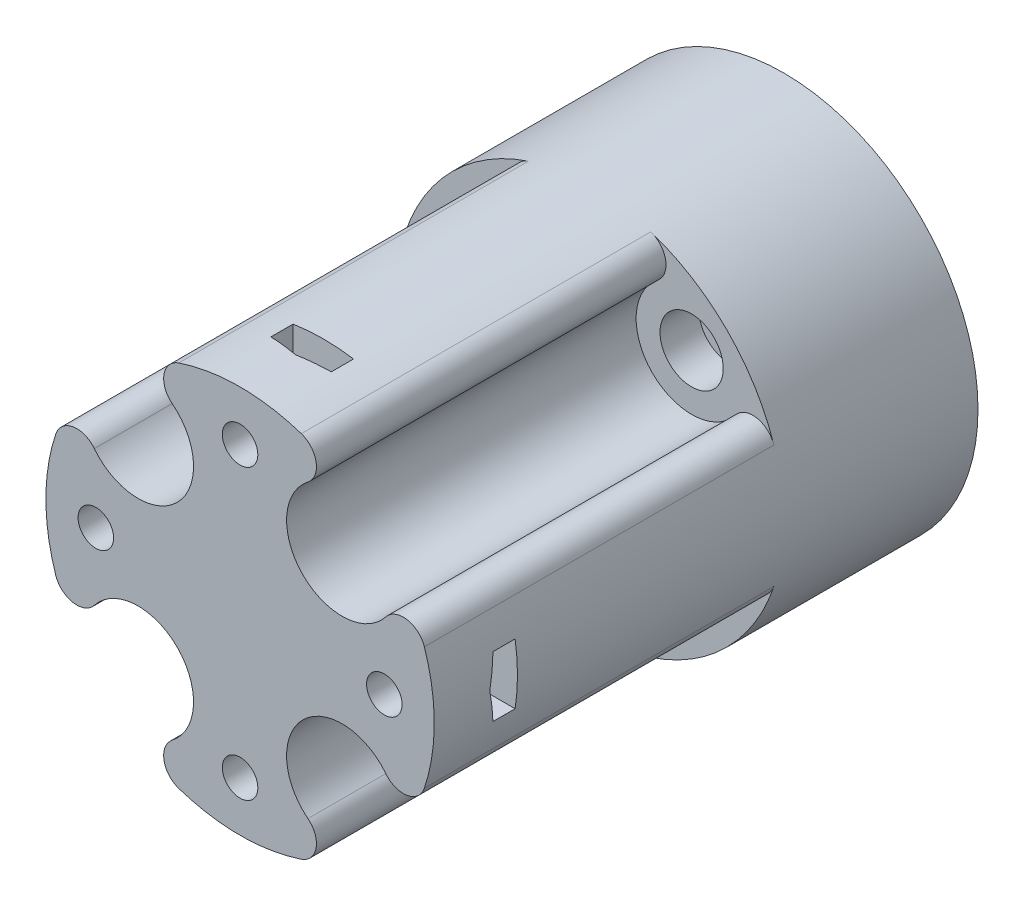
from build123d import *

# Parameters (mm, degrees)
SKETCH1_R                = 17.5
SKETCH1_R_2              = 2.85
BOSS_EXTRUDE1_DEPTH      = 48
BOSS_EXTRUDE3_START      = -1
SKETCH1_4_R              = 17.5
SKETCH1_4_R_2            = 2.85
BOSS_EXTRUDE3_DEPTH      = 1
BOSS_EXTRUDE2_DEPTH      = 13
BOSS_EXTRUDE2_DEPTH_BACK = 1
SKETCH1_3_R              = 2.85
SKETCH1_3_R_2            = 1.6
SKETCH2_R                = 5
CUT_EXTRUDE1_DEPTH       = 31.5
FILLET1_R                = 2
CUT_EXTRUDE2_START       = -7.5
SKETCH3_R                = 1.6
CUT_EXTRUDE2_DEPTH       = 2.5
CUT_EXTRUDE3_START       = -10
SKETCH3_2_R              = 1.6
CUT_EXTRUDE3_DEPTH       = 10
CHAMFER1_SIZE            = 2.75
CHAMFER1_SIZE_2          = 0.5


with BuildPart() as part:
    # Sketch1 → Boss-Extrude1 (new body)
    with BuildSketch(Plane(origin=(0, 0, 0), x_dir=(0, 1, 0), z_dir=(0, 0, 1))):
        with Locations(Location((0, 0, 0), (0, 0, 270))):
            Circle(SKETCH1_R)
        with Locations(Location((-9.192388155, 9.192388155, 0), (0, 0, 270))):
            Circle(SKETCH1_R_2, mode=Mode.SUBTRACT)
        with Locations(Location((-9.192388155, -9.192388155, 0), (0, 0, 270))):
            Circle(SKETCH1_R_2, mode=Mode.SUBTRACT)
        with Locations(Location((9.192388155, -9.192388155, 0), (0, 0, 270))):
            Circle(SKETCH1_R_2, mode=Mode.SUBTRACT)
        with Locations(Location((9.192388155, 9.192388155, 0), (0, 0, 270))):
            Circle(SKETCH1_R_2, mode=Mode.SUBTRACT)
    extrude(amount=BOSS_EXTRUDE1_DEPTH)

    # Sketch1<4> → Boss-Extrude3 (add)
    with BuildSketch(Plane(origin=(0, 0, 0), x_dir=(0, 1, 0), z_dir=(0, 0, 1)).offset(BOSS_EXTRUDE3_START)):
        with Locations(Location((0, 0, 0), (0, 0, 270))):
            Circle(SKETCH1_4_R)
        with Locations(Location((-9.192388155, 9.192388155, 0), (0, 0, 270))):
            Circle(SKETCH1_4_R_2, mode=Mode.SUBTRACT)
        with Locations(Location((-9.192388155, -9.192388155, 0), (0, 0, 270))):
            Circle(SKETCH1_4_R_2, mode=Mode.SUBTRACT)
        with Locations(Location((9.192388155, -9.192388155, 0), (0, 0, 270))):
            Circle(SKETCH1_4_R_2, mode=Mode.SUBTRACT)
        with Locations(Location((9.192388155, 9.192388155, 0), (0, 0, 270))):
            Circle(SKETCH1_4_R_2, mode=Mode.SUBTRACT)
    extrude(amount=BOSS_EXTRUDE3_DEPTH)

    # Sketch1<3> → Boss-Extrude2 (add, two sides: drawn at the far end of the back side and taken through both)
    # profile 1 of 4: a face of its own
    with BuildSketch(Plane(origin=(0, 0, 0), x_dir=(0, 1, 0), z_dir=(0, 0, 1)).offset(-BOSS_EXTRUDE2_DEPTH_BACK)):
        with Locations(Location((-9.192388155, -9.192388155, 0), (0, 0, 270))):
            Circle(SKETCH1_3_R)
        with Locations(Location((-9.192388155, -9.192388155, 0), (0, 0, 270))):
            Circle(SKETCH1_3_R_2, mode=Mode.SUBTRACT)
    # profile 2 of 4: a face of its own
    with BuildSketch(Plane(origin=(0, 0, 0), x_dir=(0, 1, 0), z_dir=(0, 0, 1)).offset(-BOSS_EXTRUDE2_DEPTH_BACK)):
        with Locations(Location((-9.192388155, 9.192388155, 0), (0, 0, 270))):
            Circle(SKETCH1_3_R)
        with Locations(Location((-9.192388155, 9.192388155, 0), (0, 0, 270))):
            Circle(SKETCH1_3_R_2, mode=Mode.SUBTRACT)
    # profile 3 of 4: a face of its own
    with BuildSketch(Plane(origin=(0, 0, 0), x_dir=(0, 1, 0), z_dir=(0, 0, 1)).offset(-BOSS_EXTRUDE2_DEPTH_BACK)):
        with Locations(Location((9.192388155, -9.192388155, 0), (0, 0, 270))):
            Circle(SKETCH1_3_R)
        with Locations(Location((9.192388155, -9.192388155, 0), (0, 0, 270))):
            Circle(SKETCH1_3_R_2, mode=Mode.SUBTRACT)
    # profile 4 of 4: a face of its own
    with BuildSketch(Plane(origin=(0, 0, 0), x_dir=(0, 1, 0), z_dir=(0, 0, 1)).offset(-BOSS_EXTRUDE2_DEPTH_BACK)):
        with Locations(Location((9.192388155, 9.192388155, 0), (0, 0, 270))):
            Circle(SKETCH1_3_R)
        with Locations(Location((9.192388155, 9.192388155, 0), (0, 0, 270))):
            Circle(SKETCH1_3_R_2, mode=Mode.SUBTRACT)
    extrude(amount=BOSS_EXTRUDE2_DEPTH + BOSS_EXTRUDE2_DEPTH_BACK)

    # Sketch2 → Cut-Extrude1 (cut)
    with BuildSketch(Plane.XY.offset(48)):
        with Locations((-9.192388155, 9.192388155)):
            Circle(SKETCH2_R)
        with Locations((9.192388155, 9.192388155)):
            Circle(SKETCH2_R)
        with Locations((9.192388155, -9.192388155)):
            Circle(SKETCH2_R)
        with Locations((-9.192388155, -9.192388155)):
            Circle(SKETCH2_R)
    extrude(amount=-CUT_EXTRUDE1_DEPTH, mode=Mode.SUBTRACT)

    # Fillet1
    fillet1_edges = [part.edges().sort_by_distance(p)[0] for p in [
        (14.028560913, -10.46181049, 32.25),
        (10.46181049, -14.028560913, 32.25),
        (10.46181049, 14.028560913, 32.25),
        (14.028560913, 10.46181049, 32.25),
        (-14.028560913, 10.46181049, 32.25),
        (-10.46181049, 14.028560913, 32.25),
        (-10.46181049, -14.028560913, 32.25),
        (-14.028560913, -10.46181049, 32.25),
    ]]
    fillet(fillet1_edges, radius=FILLET1_R)

    # Sketch3 → Cut-Extrude2 (cut)
    # profile 1 of 4: a face of its own
    with BuildSketch(Plane.XY.offset(48).offset(CUT_EXTRUDE2_START)):
        with BuildLine():
            Line((-2.725057077, 15.725171237), (-2.725057077, 17.286528394))
            ThreePointArc((-2.725057077, 17.286528394), (-5.7782e-05, 17.5), (2.724942923, 17.286546389))
            Line((2.724942923, 17.286546389), (2.724942923, 15.724942923))
            Line((2.724942923, 15.724942923), (2.724942923, 10.274942923))
            Line((2.724942923, 10.274942923), (-2.725057077, 10.274942923))
            Line((-2.725057077, 10.274942923), (-2.725057077, 15.725171237))
        make_face()
        with Locations((0, 13)):
            Circle(SKETCH3_R, mode=Mode.SUBTRACT)
    # profile 2 of 4: a face of its own
    with BuildSketch(Plane.XY.offset(48).offset(CUT_EXTRUDE2_START)):
        with BuildLine():
            Line((15.724942923, -2.724942923), (10.274942923, -2.724942923))
            Line((10.274942923, -2.724942923), (10.274942923, 2.725057077))
            Line((10.274942923, 2.725057077), (15.725171237, 2.725057077))
            Line((15.725171237, 2.725057077), (17.286528394, 2.725057077))
            ThreePointArc((17.286528394, 2.725057077), (17.5, 5.7782e-05), (17.286546389, -2.724942923))
            Line((17.286546389, -2.724942923), (15.724942923, -2.724942923))
        make_face()
        with Locations((13, 0)):
            Circle(SKETCH3_R, mode=Mode.SUBTRACT)
    # profile 3 of 4: a face of its own
    with BuildSketch(Plane.XY.offset(48).offset(CUT_EXTRUDE2_START)):
        with BuildLine():
            Line((-2.724942923, -15.724942923), (-2.724942923, -10.274942923))
            Line((-2.724942923, -10.274942923), (2.725057077, -10.274942923))
            Line((2.725057077, -10.274942923), (2.725057077, -15.725171237))
            Line((2.725057077, -15.725171237), (2.725057077, -17.286528394))
            ThreePointArc((2.725057077, -17.286528394), (5.7782e-05, -17.5), (-2.724942923, -17.286546389))
            Line((-2.724942923, -17.286546389), (-2.724942923, -15.724942923))
        make_face()
        with Locations((0, -13)):
            Circle(SKETCH3_R, mode=Mode.SUBTRACT)
    # profile 4 of 4: a face of its own
    with BuildSketch(Plane.XY.offset(48).offset(CUT_EXTRUDE2_START)):
        with BuildLine():
            Line((-15.724942923, 2.724942923), (-10.274942923, 2.724942923))
            Line((-10.274942923, 2.724942923), (-10.274942923, -2.725057077))
            Line((-10.274942923, -2.725057077), (-15.725171237, -2.725057077))
            Line((-15.725171237, -2.725057077), (-17.286528394, -2.725057077))
            ThreePointArc((-17.286528394, -2.725057077), (-17.5, -5.7782e-05), (-17.286546389, 2.724942923))
            Line((-17.286546389, 2.724942923), (-15.724942923, 2.724942923))
        make_face()
        with Locations((-13, 0)):
            Circle(SKETCH3_R, mode=Mode.SUBTRACT)
    extrude(amount=CUT_EXTRUDE2_DEPTH, mode=Mode.SUBTRACT)

    # Sketch3<2> → Cut-Extrude3 (cut)
    with BuildSketch(Plane.XY.offset(48).offset(CUT_EXTRUDE3_START)):
        with Locations((-13, 0)):
            Circle(SKETCH3_2_R)
        with Locations((0, 13)):
            Circle(SKETCH3_2_R)
        with Locations((13, 0)):
            Circle(SKETCH3_2_R)
        with Locations((0, -13)):
            Circle(SKETCH3_2_R)
    extrude(amount=CUT_EXTRUDE3_DEPTH, mode=Mode.SUBTRACT)

    # Chamfer1
    # the kernel refuses this chamfer: 2.75, 0.5 mm, written as the material it adds along each edge
    with BuildSketch(Plane(origin=(-3.129209364, -2.725057077, 43), x_dir=(0, 0.9999763028084744, 0.006884317068104265), z_dir=(-1, 0, 0))) as chamfer1_piece_1_section:
        Polygon((CHAMFER1_SIZE * 0.999976302808, CHAMFER1_SIZE * 0.0068843170681), (-CHAMFER1_SIZE_2 * 0.0068843170681, CHAMFER1_SIZE_2 * 0.999976302808), (0, 0), align=None)
    chamfer1_piece_1 = extrude(amount=21.30305259, mode=Mode.PRIVATE)
    chamfer1_piece_1 = chamfer1_piece_1 & Plane(origin=(0, 0, 42.863927103), x_dir=(1, 0, 0), z_dir=(0, 0, -1)) * Cylinder(17.5, 54, mode=Mode.PRIVATE)
    chamfer1_piece_1 = chamfer1_piece_1 - Plane(origin=(-13, 0, 42.863927103), x_dir=(1, 0, 0), z_dir=(0, 0, -1)) * Cylinder(1.6, 54, mode=Mode.PRIVATE)
    add(chamfer1_piece_1)
    with BuildSketch(Plane(origin=(-24.432279948, 2.724942923, 43), x_dir=(0, 0.20388124945923355, -0.9789956262001082), z_dir=(1, 0, 0))) as chamfer1_piece_2_section:
        Polygon((CHAMFER1_SIZE_2 * 0.9789956262, -CHAMFER1_SIZE_2 * 0.203881249459), (-CHAMFER1_SIZE * 0.203881249459, -CHAMFER1_SIZE * 0.9789956262), (0, 0), align=None)
    chamfer1_piece_2 = extrude(amount=21.303070585, mode=Mode.PRIVATE)
    chamfer1_piece_2 = chamfer1_piece_2 & Plane(origin=(0, 0, 42.851795499), x_dir=(1, 0, 0), z_dir=(0, 0, -1)) * Cylinder(17.5, 54, mode=Mode.PRIVATE)
    chamfer1_piece_2 = chamfer1_piece_2 - Plane(origin=(-13, 0, 42.851795499), x_dir=(1, 0, 0), z_dir=(0, 0, -1)) * Cylinder(1.6, 54, mode=Mode.PRIVATE)
    add(chamfer1_piece_2)
    with BuildSketch(Plane(origin=(-2.725057077, 3.129209364, 43), x_dir=(0.9999763028084744, 0, 0.006884317068104265), z_dir=(0, 1, 0))) as chamfer1_piece_3_section:
        Polygon((CHAMFER1_SIZE * 0.999976302808, CHAMFER1_SIZE * 0.0068843170681), (-CHAMFER1_SIZE_2 * 0.0068843170681, CHAMFER1_SIZE_2 * 0.999976302808), (0, 0), align=None)
    chamfer1_piece_3 = extrude(amount=21.30305259, mode=Mode.PRIVATE)
    chamfer1_piece_3 = chamfer1_piece_3 & Plane(origin=(0, 0, 42.863927103), x_dir=(1, 0, 0), z_dir=(0, 0, -1)) * Cylinder(17.5, 54, mode=Mode.PRIVATE)
    chamfer1_piece_3 = chamfer1_piece_3 - Plane(origin=(0, 13, 42.863927103), x_dir=(1, 0, 0), z_dir=(0, 0, -1)) * Cylinder(1.6, 54, mode=Mode.PRIVATE)
    add(chamfer1_piece_3)
    with BuildSketch(Plane(origin=(2.724942923, 24.432279948, 43), x_dir=(0.20388124945923355, 0, -0.9789956262001082), z_dir=(0, -1, 0))) as chamfer1_piece_4_section:
        Polygon((CHAMFER1_SIZE_2 * 0.9789956262, -CHAMFER1_SIZE_2 * 0.203881249459), (-CHAMFER1_SIZE * 0.203881249459, -CHAMFER1_SIZE * 0.9789956262), (0, 0), align=None)
    chamfer1_piece_4 = extrude(amount=21.303070585, mode=Mode.PRIVATE)
    chamfer1_piece_4 = chamfer1_piece_4 & Plane(origin=(0, 0, 42.851795495), x_dir=(1, 0, 0), z_dir=(0, 0, -1)) * Cylinder(17.5, 54, mode=Mode.PRIVATE)
    chamfer1_piece_4 = chamfer1_piece_4 - Plane(origin=(0, 13, 42.851795495), x_dir=(1, 0, 0), z_dir=(0, 0, -1)) * Cylinder(1.6, 54, mode=Mode.PRIVATE)
    add(chamfer1_piece_4)
    with BuildSketch(Plane(origin=(3.129209364, 2.725057077, 43), x_dir=(0, -0.9999763028084744, 0.006884317068104265), z_dir=(1, 0, 0))) as chamfer1_piece_5_section:
        Polygon((CHAMFER1_SIZE * 0.999976302808, CHAMFER1_SIZE * 0.0068843170681), (-CHAMFER1_SIZE_2 * 0.0068843170681, CHAMFER1_SIZE_2 * 0.999976302808), (0, 0), align=None)
    chamfer1_piece_5 = extrude(amount=21.30305259, mode=Mode.PRIVATE)
    chamfer1_piece_5 = chamfer1_piece_5 & Plane(origin=(0, 0, 42.863927103), x_dir=(1, 0, 0), z_dir=(0, 0, -1)) * Cylinder(17.5, 54, mode=Mode.PRIVATE)
    chamfer1_piece_5 = chamfer1_piece_5 - Plane(origin=(13, 0, 42.863927103), x_dir=(1, 0, 0), z_dir=(0, 0, -1)) * Cylinder(1.6, 54, mode=Mode.PRIVATE)
    add(chamfer1_piece_5)
    with BuildSketch(Plane(origin=(24.432279948, -2.724942923, 43), x_dir=(0, 0.9999763028084744, 0.006884317068104265), z_dir=(-1, 0, 0))) as chamfer1_piece_6_section:
        Polygon((CHAMFER1_SIZE * 0.999976302808, CHAMFER1_SIZE * 0.0068843170681), (-CHAMFER1_SIZE_2 * 0.0068843170681, CHAMFER1_SIZE_2 * 0.999976302808), (0, 0), align=None)
    chamfer1_piece_6 = extrude(amount=21.303070585, mode=Mode.PRIVATE)
    chamfer1_piece_6 = chamfer1_piece_6 & Plane(origin=(0, 0, 42.851795381), x_dir=(1, 0, 0), z_dir=(0, 0, -1)) * Cylinder(17.5, 54, mode=Mode.PRIVATE)
    chamfer1_piece_6 = chamfer1_piece_6 - Plane(origin=(13, 0, 42.851795381), x_dir=(1, 0, 0), z_dir=(0, 0, -1)) * Cylinder(1.6, 54, mode=Mode.PRIVATE)
    add(chamfer1_piece_6)
    with BuildSketch(Plane(origin=(2.725057077, -3.129209364, 43), x_dir=(-0.9999763028084744, 0, 0.006884317068104265), z_dir=(0, -1, 0))) as chamfer1_piece_7_section:
        Polygon((CHAMFER1_SIZE * 0.999976302808, CHAMFER1_SIZE * 0.0068843170681), (-CHAMFER1_SIZE_2 * 0.0068843170681, CHAMFER1_SIZE_2 * 0.999976302808), (0, 0), align=None)
    chamfer1_piece_7 = extrude(amount=21.30305259, mode=Mode.PRIVATE)
    chamfer1_piece_7 = chamfer1_piece_7 & Plane(origin=(0, 0, 42.863927103), x_dir=(1, 0, 0), z_dir=(0, 0, -1)) * Cylinder(17.5, 54, mode=Mode.PRIVATE)
    chamfer1_piece_7 = chamfer1_piece_7 - Plane(origin=(0, -13, 42.863927103), x_dir=(1, 0, 0), z_dir=(0, 0, -1)) * Cylinder(1.6, 54, mode=Mode.PRIVATE)
    add(chamfer1_piece_7)
    with BuildSketch(Plane(origin=(-2.724942923, -24.432279948, 43), x_dir=(-0.20388124945923355, 0, -0.9789956262001082), z_dir=(0, 1, 0))) as chamfer1_piece_8_section:
        Polygon((CHAMFER1_SIZE_2 * 0.9789956262, -CHAMFER1_SIZE_2 * 0.203881249459), (-CHAMFER1_SIZE * 0.203881249459, -CHAMFER1_SIZE * 0.9789956262), (0, 0), align=None)
    chamfer1_piece_8 = extrude(amount=21.303070585, mode=Mode.PRIVATE)
    chamfer1_piece_8 = chamfer1_piece_8 & Plane(origin=(0, 0, 42.851795444), x_dir=(1, 0, 0), z_dir=(0, 0, -1)) * Cylinder(17.5, 54, mode=Mode.PRIVATE)
    chamfer1_piece_8 = chamfer1_piece_8 - Plane(origin=(0, -13, 42.851795444), x_dir=(1, 0, 0), z_dir=(0, 0, -1)) * Cylinder(1.6, 54, mode=Mode.PRIVATE)
    add(chamfer1_piece_8)


solid = part.part
